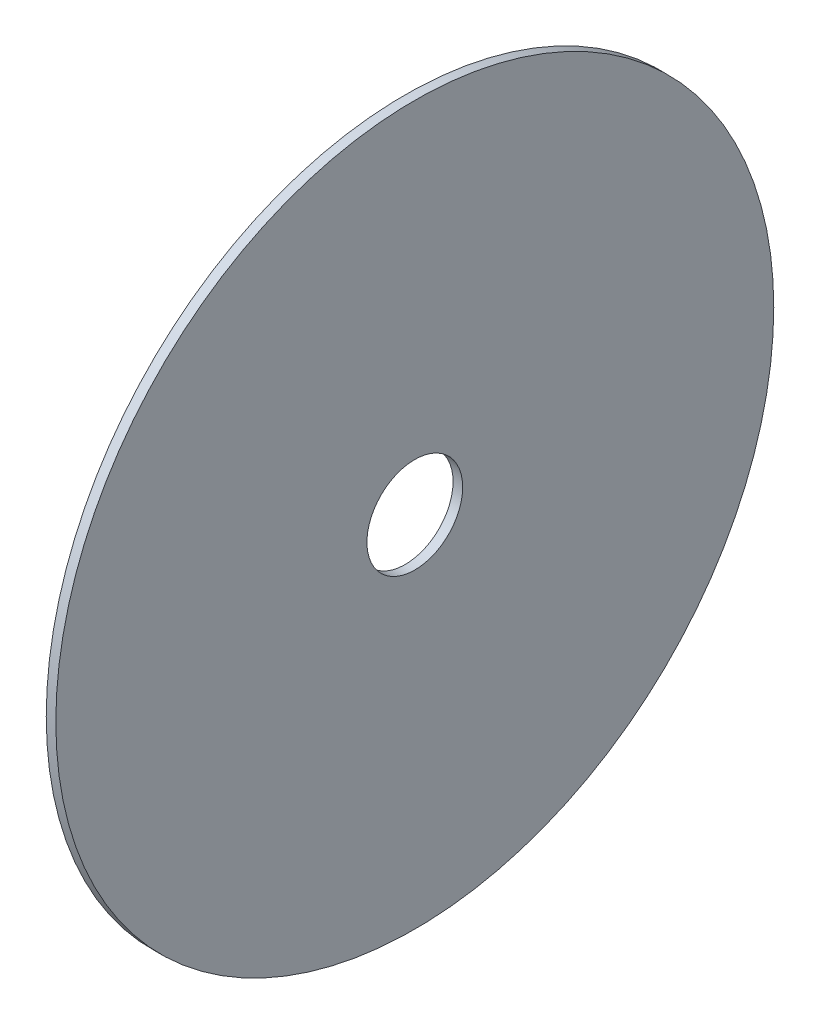
from build123d import *

# Parameters (mm, degrees)
SKETCH_1_R      = 75
SKETCH_1_R_2    = 10
EXTRUDE_1_DEPTH = 2


with BuildPart() as part:
    # Эскиз1 → Бобышка-Вытянуть1 (new body)
    with BuildSketch(Plane(origin=(0, 0, 0), x_dir=(0, 0, -1), z_dir=(1, 0, 0))):
        Circle(SKETCH_1_R)
        Circle(SKETCH_1_R_2, mode=Mode.SUBTRACT)
    extrude(amount=EXTRUDE_1_DEPTH)


solid = part.part
